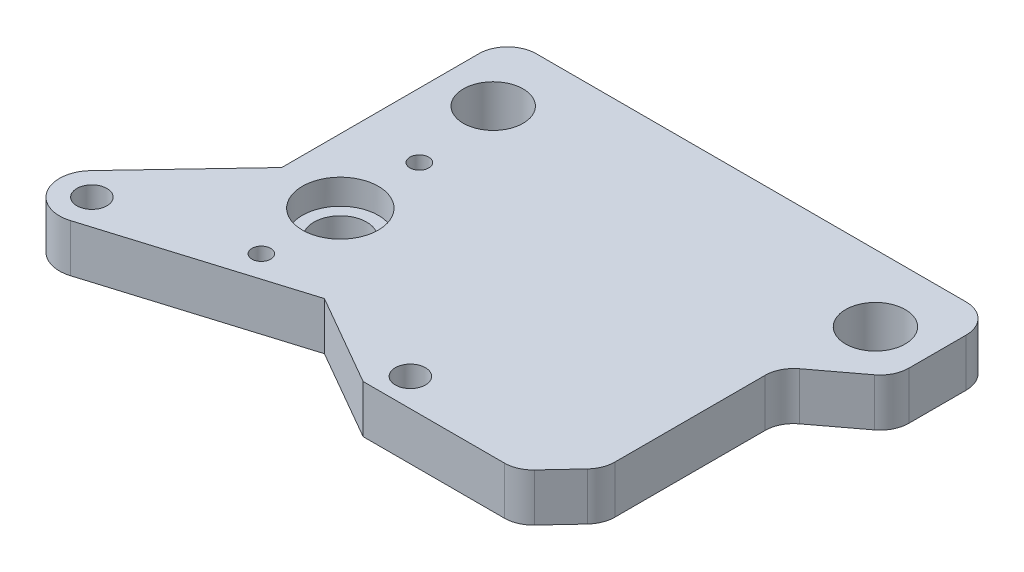
from build123d import *

# Parameters (mm, degrees)
SKETCH4_R           = 2
SKETCH4_R_2         = 1.25
SKETCH4_R_3         = 5.05
SKETCH4_R_4         = 3.96875
BOSS_EXTRUDE2_DEPTH = 6.35
SKETCH31_R          = 6.35
SKETCH31_R_2        = 3.499999985
BOSS_EXTRUDE5_DEPTH = 3


with BuildPart() as part:
    # Sketch4 → Boss-Extrude2 (new body)
    with BuildSketch(Plane(origin=(0, 0, 0), x_dir=(1, 0, 0), z_dir=(0, 1, 0))):
        with BuildLine():
            Line((21.46596982, -18.4375), (40.257702493, -18.4375))
            ThreePointArc((40.257702493, -18.4375), (41.776936446, -18.121498883), (43.044160097, -17.225913752))
            Line((43.044160097, -17.225913752), (46.444939319, -13.579024524))
            ThreePointArc((46.444939319, -13.579024524), (47.203372649, -12.376980446), (47.468481715, -10.980610773))
            Line((47.468481715, -10.980610773), (47.468481715, 8.985116992))
            ThreePointArc((47.468481715, 8.985116992), (47.868781798, 10.685130659), (48.985566477, 12.027918285))
            Line((48.985566477, 12.027918285), (54.680415238, 16.319294633))
            ThreePointArc((54.680415238, 16.319294633), (55.797199918, 17.662082259), (56.1975, 19.362095927))
            Line((56.1975, 19.362095927), (56.1975, 26.9875))
            ThreePointArc((56.1975, 26.9875), (55.081576836, 29.681576836), (52.3875, 30.7975))
            Line((52.3875, 30.7975), (-4.7625, 30.7975))
            ThreePointArc((-4.7625, 30.7975), (-7.456576836, 29.681576836), (-8.5725, 26.9875))
            Line((-8.5725, 26.9875), (-8.5725, 0.781747009))
            Line((-8.5725, 0.781747009), (-20.917416467, -12.27322702))
            ThreePointArc((-20.917416467, -12.27322702), (-21.4498857, -17.515316011), (-16.517810325, -19.369406885))
            Line((-16.517810325, -19.369406885), (9.346561417, -11.463733294))
            Line((9.346561417, -11.463733294), (21.46596982, -18.4375))
        make_face()
        with Locations((-17.78, -15.24)):
            Circle(SKETCH4_R, mode=Mode.SUBTRACT)
        with Locations((0, -10.5)):
            Circle(SKETCH4_R_2, mode=Mode.SUBTRACT)
        Circle(SKETCH4_R_3, mode=Mode.SUBTRACT)
        with Locations((24.012521227, -14.703599027)):
            Circle(SKETCH4_R, mode=Mode.SUBTRACT)
        with Locations((0, 10.5)):
            Circle(SKETCH4_R_2, mode=Mode.SUBTRACT)
        with Locations((-1.5875, 21.9075)):
            Circle(SKETCH4_R_4, mode=Mode.SUBTRACT)
        with Locations((49.2125, 21.9075)):
            Circle(SKETCH4_R_4, mode=Mode.SUBTRACT)
    extrude(amount=-BOSS_EXTRUDE2_DEPTH)

    # Sketch31 → Boss-Extrude5 (add)
    with BuildSketch(Plane.XZ.offset(6.35)):
        Circle(SKETCH31_R)
        Circle(SKETCH31_R_2, mode=Mode.SUBTRACT)
    extrude(amount=-BOSS_EXTRUDE5_DEPTH)


solid = part.part
